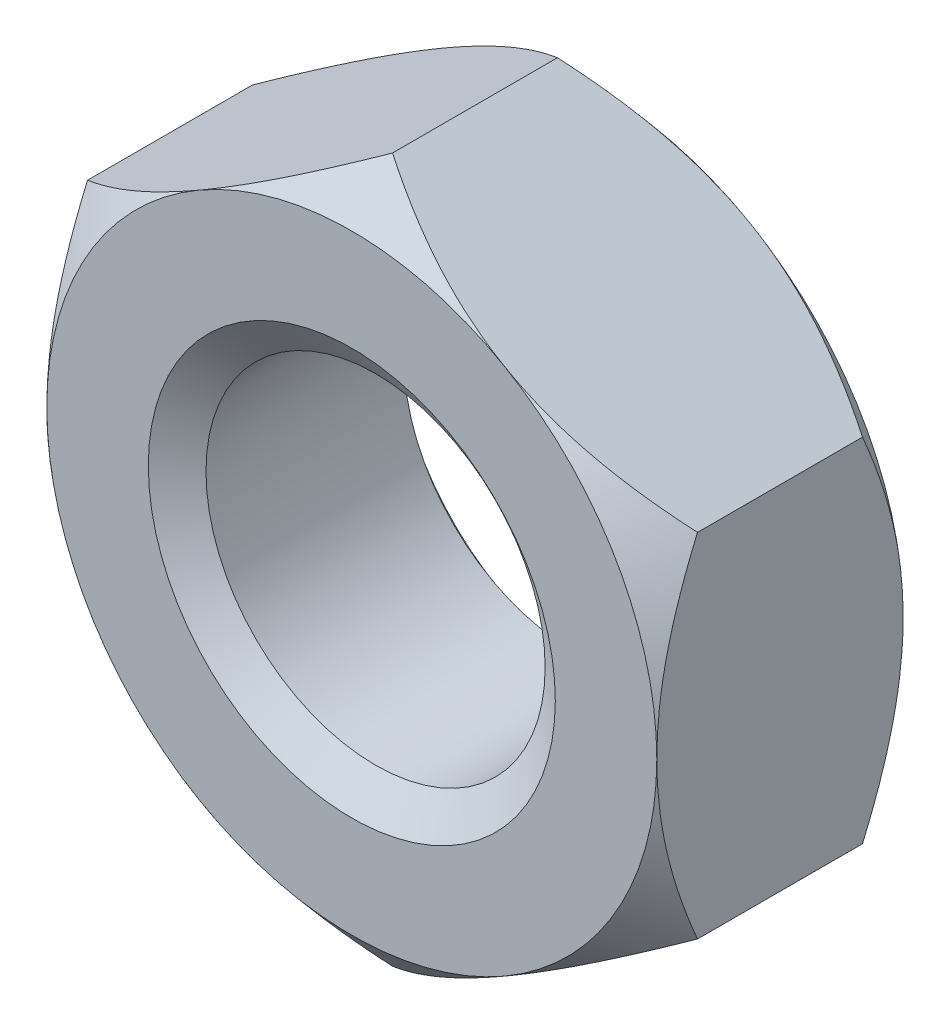
from build123d import *

# Parameters (mm, degrees)
THREADSCHEMATIC_START     = -5.7658
THREADSCHEMATIC_OUTLINE_R = 3.96875
THREADSCHEMATIC_DEPTH     = 5.7658


# Read off the part's stored shape, not the designer's step: ThreadSchematic
with BuildPart() as part:
    # ThreadSchematic outline → ThreadSchematic (new body)
    with BuildSketch(Plane.XY.offset(THREADSCHEMATIC_START)):
        Polygon((7.1374, 4.120779811), (0, 8.241559623), (-7.1374, 4.120779811), (-7.1374, -4.120779811), (0, -8.241559623), (7.1374, -4.120779811), align=None)
        Circle(THREADSCHEMATIC_OUTLINE_R, mode=Mode.SUBTRACT)
    extrude(amount=THREADSCHEMATIC_DEPTH)

    # Sketch3 → Double-Chamfer (revolve, cut)
    with BuildSketch(Plane(origin=(0, 0, 0), x_dir=(0, 0, -1), z_dir=(1, 0, 0))):
        Polygon((5.7658, 7.1374), (4.8133, 8.241559623), (4.8133, 20.941559623), (18.4658, 20.941559623), (18.4658, 7.1374), align=None)
        Polygon((0.9525, 20.941559623), (-12.7, 20.941559623), (-12.7, 7.1374), (0, 7.1374), (0.9525, 8.241559623), align=None)
    revolve(axis=Axis((0, 0, 0), (0, 0, -1)), mode=Mode.SUBTRACT)

    # EndChamferSke → EndChamfer (revolve, cut)
    with BuildSketch(Plane(origin=(0, 0, 0), x_dir=(0, 0, -1), z_dir=(1, 0, 0)), mode=Mode.PRIVATE) as endchamfer_sk:
        Polygon((5.7404, 4.7625), (5.129031293, 3.889375), (5.7912, 3.889375), (5.7912, 4.7625), align=None)
        Polygon((-0.0508, 4.7625), (0, 4.7625), (0.611368707, 3.889375), (-0.0508, 3.889375), align=None)
    revolve(endchamfer_sk.sketch.rotate(Axis((0, 0, -25.037505729), (0, 0, -1)), 90), axis=Axis((0, 0, -25.037505729), (0, 0, -1)), mode=Mode.SUBTRACT)


solid = part.part
